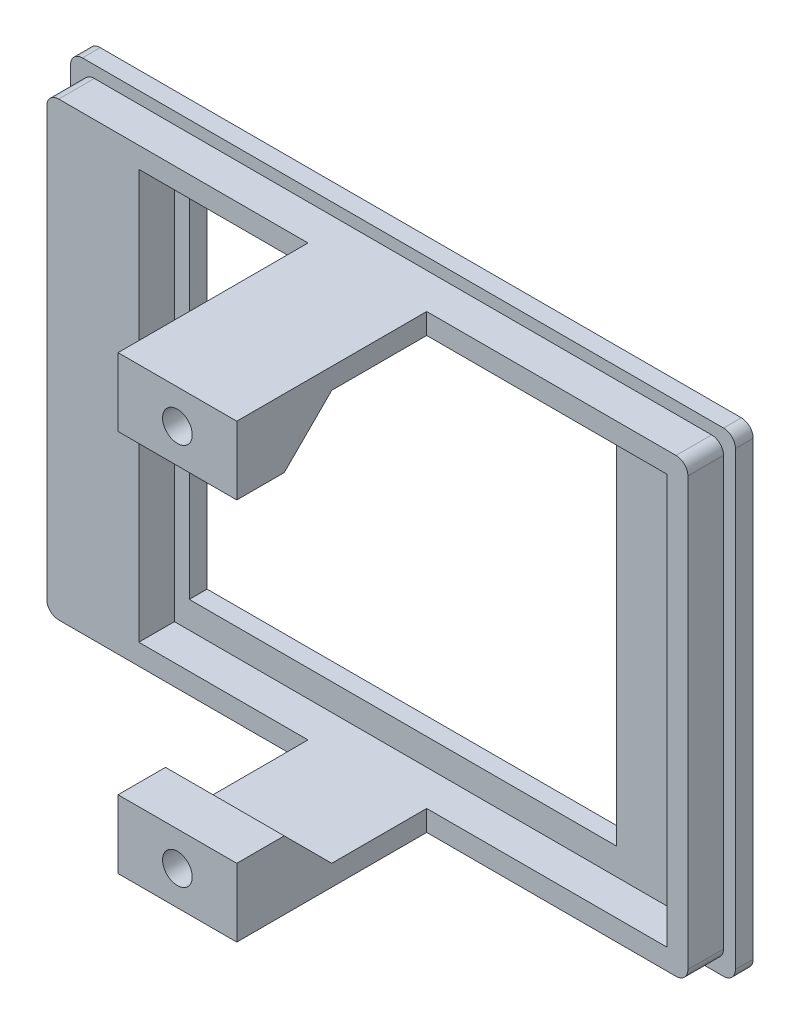
from build123d import *

# Parameters (mm, degrees)
SKETCH1_W           = 56
SKETCH1_H           = 40
SKETCH1_W_2         = 36
SKETCH1_H_2         = 30
BOSS_EXTRUDE1_DEPTH = 1.5
SKETCH2_W           = 54
SKETCH2_H           = 38
SKETCH2_W_2         = 44.5
SKETCH2_H_2         = 34.5
BOSS_EXTRUDE2_DEPTH = 3
SKETCH3_W           = 10
SKETCH3_H           = 1.75
BOSS_EXTRUDE3_DEPTH = 16
SKETCH4_W           = 10
SKETCH4_H           = 4
BOSS_EXTRUDE4_DEPTH = 4
SKETCH6_W           = 10
SKETCH6_H           = 4
BOSS_EXTRUDE5_DEPTH = 4
CHAMFER1_SIZE       = 4
SKETCH7_R           = 1.25
CUT_EXTRUDE2_DEPTH  = 6
FILLET1_R           = 1


with BuildPart() as part:
    # Sketch1 → Boss-Extrude1 (new body)
    with BuildSketch(Plane.XY):
        Rectangle(SKETCH1_W, SKETCH1_H)
        Rectangle(SKETCH1_W_2, SKETCH1_H_2, mode=Mode.SUBTRACT)
    extrude(amount=BOSS_EXTRUDE1_DEPTH)

    # Sketch2 → Boss-Extrude2 (add)
    with BuildSketch(Plane.XY.offset(1.5)):
        Rectangle(SKETCH2_W, SKETCH2_H)
        with Locations((3, 0)):
            Rectangle(SKETCH2_W_2, SKETCH2_H_2, mode=Mode.SUBTRACT)
    extrude(amount=BOSS_EXTRUDE2_DEPTH)

    # Sketch3 → Boss-Extrude3 (add)
    with BuildSketch(Plane.XY.offset(4.5)):
        with Locations((0, 18.125)):
            Rectangle(SKETCH3_W, SKETCH3_H)
        with Locations((0, -18.125)):
            Rectangle(SKETCH3_W, SKETCH3_H)
    extrude(amount=BOSS_EXTRUDE3_DEPTH)

    # Sketch4 → Boss-Extrude4 (add)
    with BuildSketch(Plane(origin=(0, 17.25, 0), x_dir=(-1, 0, 0), z_dir=(0, -1, 0))):
        with Locations((0, -18.5)):
            Rectangle(SKETCH4_W, SKETCH4_H)
    extrude(amount=BOSS_EXTRUDE4_DEPTH)

    # Sketch6 → Boss-Extrude5 (add)
    with BuildSketch(Plane(origin=(0, -17.25, 0), x_dir=(1, 0, 0), z_dir=(0, 1, 0))):
        with Locations((0, -18.5)):
            Rectangle(SKETCH6_W, SKETCH6_H)
    extrude(amount=BOSS_EXTRUDE5_DEPTH)

    # Chamfer1
    chamfer1_edges = [part.edges().sort_by_distance(p)[0] for p in [
        (0, -17.25, 16.5),
        (0, 17.25, 16.5),
    ]]
    chamfer(chamfer1_edges, length=CHAMFER1_SIZE - 0.0001)  # a hair under: the kernel refuses the full size

    # Sketch7 → Cut-Extrude2 (cut)
    with BuildSketch(Plane.XY.offset(20.5)):
        with Locations((0, 16.125)):
            Circle(SKETCH7_R)
        with Locations((0, -16.125)):
            Circle(SKETCH7_R)
    extrude(amount=-CUT_EXTRUDE2_DEPTH, mode=Mode.SUBTRACT)

    # Fillet1
    fillet1_edges = [part.edges().sort_by_distance(p)[0] for p in [
        (-27, 19, 3),
        (-27, -19, 3),
        (27, -19, 3),
        (27, 19, 3),
        (-28, 20, 0.75),
        (28, 20, 0.75),
        (28, -20, 0.75),
        (-28, -20, 0.75),
    ]]
    fillet(fillet1_edges, radius=FILLET1_R)


solid = part.part
